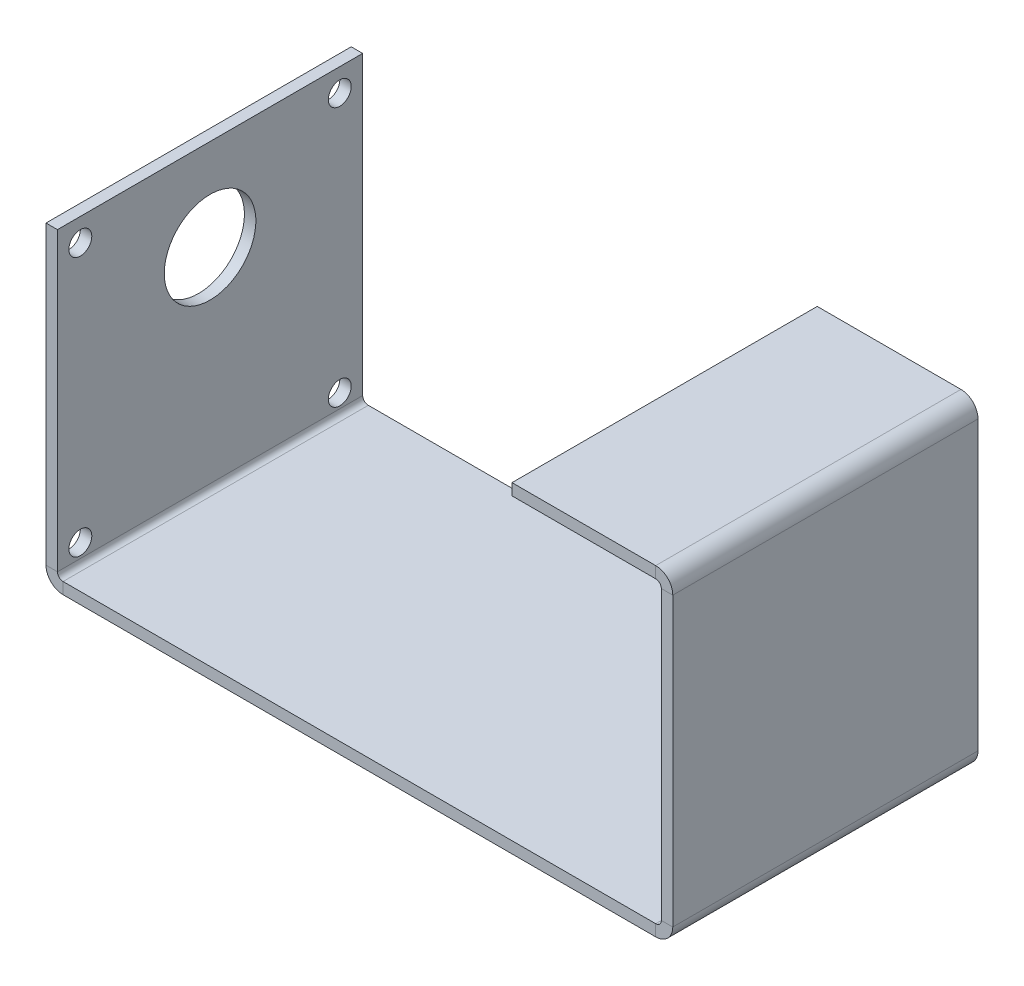
from build123d import *
from build123d.topology import SkipClean

# Parameters (mm, degrees)
SKETCH1_R               = 6
SKETCH1_R_2             = 1.5
BASE_FLANGE2_DEPTH      = 1.5
SKETCHED_START          = -40
SKETCHED_BEND1_DEPTH    = 40
SKETCHED_BEND1_2_DEPTH  = 40
SKETCHED_START_2        = -35.4999999
SKETCHED_BEND1_3_DEPTH  = 9.4999998
SKETCHED_START_3        = -13.9999999
SKETCHED_BEND1_4_DEPTH  = 9.4999998
SKETCHED_BEND1_5_DEPTH  = 1.4999999
SKETCHED_START_4        = -1.4999999
SKETCHED_BEND1_6_DEPTH  = 1.4999999
SKETCHED_START_5        = 38.93097291
SKETCHED_BEND1_7_DEPTH  = 1.5
SKETCHED_START_6        = 40.43097291
SKETCHED_BEND1_8_DEPTH  = 0.618240168
SKETCHED_START_7        = -38.5000001
SKETCHED_BEND1_9_DEPTH  = 37.00000011
SKETCHED_BEND1_10_DEPTH = 37.00000011


with BuildPart() as part:
    # Base-Flange2: sheet metal written as solids
    # Sketch1 → Base-Flange2 (new body)
    with BuildSketch(Plane(origin=(0, 0, 0), x_dir=(1, 0, 0), z_dir=(0, 1, 0))):
        Polygon((0, 0), (40, 0), (120, 0), (160, 0), (180, 0), (180, 40), (160, 40), (120, 40), (40, 40), (0, 40), align=None)
        with Locations(Location((12, 20, 0), (0, 0, 270))):
            Circle(SKETCH1_R, mode=Mode.SUBTRACT)
        with Locations(Location((3, 37, 0), (0, 0, 270))):
            Circle(SKETCH1_R_2, mode=Mode.SUBTRACT)
        with Locations(Location((37, 37, 0), (0, 0, 270))):
            Circle(SKETCH1_R_2, mode=Mode.SUBTRACT)
        with Locations(Location((37, 3, 0), (0, 0, 270))):
            Circle(SKETCH1_R_2, mode=Mode.SUBTRACT)
        with Locations(Location((3, 3, 0), (0, 0, 270))):
            Circle(SKETCH1_R_2, mode=Mode.SUBTRACT)
    extrude(amount=-BASE_FLANGE2_DEPTH)

    # Sketched Bend1: read off the stored shape, not the designer's step
    # Sketched Bend1 outline → Sketched Bend1 (cut)
    with BuildSketch(Plane.XY.offset(SKETCHED_START)):
        with BuildLine():
            Line((180, 0), (120.944250946, 0))
            ThreePointArc((120.944250946, 0), (120.127591172, -1.086838938), (118.83242709, -1.5))
            Line((118.83242709, -1.5), (180, -1.5))
            Line((180, -1.5), (180, 0))
        make_face()
        with BuildLine():
            Line((0, -1.5), (41.16757291, -1.5))
            ThreePointArc((41.16757291, -1.5), (39.872408828, -1.086838938), (39.055749054, 0))
            Line((39.055749054, 0), (0, 0))
            Line((0, 0), (0, -1.5))
        make_face()
    extrude(amount=SKETCHED_BEND1_DEPTH, mode=Mode.SUBTRACT)

    # Sketched Bend1 2 outline → Sketched Bend1 2 (add)
    with BuildSketch(Plane.XY.offset(SKETCHED_START)):
        with BuildLine():
            ThreePointArc((120.944250946, 0), (121.037612433, 0.363053267), (121.06902709, 0.7366))
            Line((121.06902709, 0.7366), (121.06902709, 38.401454181))
            ThreePointArc((121.06902709, 38.401454181), (120.413942116, 39.982969207), (118.83242709, 40.638054181))
            Line((118.83242709, 40.638054181), (100, 40.638054181))
            Line((100, 40.638054181), (100, 39.138054181))
            Line((100, 39.138054181), (118.83242709, 39.138054181))
            ThreePointArc((118.83242709, 39.138054181), (119.353281945, 38.922309036), (119.56902709, 38.401454181))
            Line((119.56902709, 38.401454181), (119.56902709, 0.7366))
            ThreePointArc((119.56902709, 0.7366), (119.353281945, 0.215745145), (118.83242709, 0))
            Line((118.83242709, 0), (120.944250946, 0))
        make_face()
    extrude(amount=SKETCHED_BEND1_2_DEPTH)

    # Sketched Bend1 3 outline → Sketched Bend1 3 (add)
    with BuildSketch(Plane.XY.offset(SKETCHED_START_2)):
        with BuildLine():
            Line((39.055749054, 0), (41.16757291, 0))
            ThreePointArc((41.16757291, 0), (40.646718055, 0.215745145), (40.43097291, 0.7366))
            Line((40.43097291, 0.7366), (40.43097291, 39.56902709))
            Line((40.43097291, 39.56902709), (38.93097291, 39.56902709))
            Line((38.93097291, 39.56902709), (38.93097291, 0.7366))
            ThreePointArc((38.93097291, 0.7366), (38.962387567, 0.363053267), (39.055749054, 0))
        make_face()
    extrude(amount=SKETCHED_BEND1_3_DEPTH)

    # Sketched Bend1 4 outline → Sketched Bend1 4 (add)
    with BuildSketch(Plane.XY.offset(SKETCHED_START_3)):
        with BuildLine():
            Line((39.055749054, 0), (41.16757291, 0))
            ThreePointArc((41.16757291, 0), (40.646718055, 0.215745145), (40.43097291, 0.7366))
            Line((40.43097291, 0.7366), (40.43097291, 39.56902709))
            Line((40.43097291, 39.56902709), (38.93097291, 39.56902709))
            Line((38.93097291, 39.56902709), (38.93097291, 0.7366))
            ThreePointArc((38.93097291, 0.7366), (38.962387567, 0.363053267), (39.055749054, 0))
        make_face()
    extrude(amount=SKETCHED_BEND1_4_DEPTH)

    # Sketched Bend1 5 outline → Sketched Bend1 5 (add)
    with BuildSketch(Plane.XY.offset(SKETCHED_START)):
        with BuildLine():
            Line((39.055749054, 0), (41.16757291, 0))
            ThreePointArc((41.16757291, 0), (40.646718055, 0.215745145), (40.43097291, 0.7366))
            Line((40.43097291, 0.7366), (40.43097291, 39.56902709))
            Line((40.43097291, 39.56902709), (38.93097291, 39.56902709))
            Line((38.93097291, 39.56902709), (38.93097291, 0.7366))
            ThreePointArc((38.93097291, 0.7366), (38.962387567, 0.363053267), (39.055749054, 0))
        make_face()
    extrude(amount=SKETCHED_BEND1_5_DEPTH)

    # Sketched Bend1 6 outline → Sketched Bend1 6 (add)
    with BuildSketch(Plane.XY.offset(SKETCHED_START_4)):
        with BuildLine():
            Line((39.055749054, 0), (41.16757291, 0))
            ThreePointArc((41.16757291, 0), (40.646718055, 0.215745145), (40.43097291, 0.7366))
            Line((40.43097291, 0.7366), (40.43097291, 39.56902709))
            Line((40.43097291, 39.56902709), (38.93097291, 39.56902709))
            Line((38.93097291, 39.56902709), (38.93097291, 0.7366))
            ThreePointArc((38.93097291, 0.7366), (38.962387567, 0.363053267), (39.055749054, 0))
        make_face()
    extrude(amount=SKETCHED_BEND1_6_DEPTH)

    # Sketched Bend1 7 outline → Sketched Bend1 7 (add)
    with BuildSketch(Plane.YZ.offset(SKETCHED_START_5)):
        with BuildLine():
            Line((36.56902709, -38.5), (39.56902709, -38.5000001))
            Line((39.56902709, -38.5000001), (39.56902709, -35.4999999))
            Line((39.56902709, -35.4999999), (36.56902709, -35.5))
            ThreePointArc((36.56902709, -35.5), (38.06902709, -37), (36.56902709, -38.5))
        make_face()
        with BuildLine():
            Line((2.569027031, -38.5), (36.56902709, -38.5))
            ThreePointArc((36.56902709, -38.5), (35.06902709, -37), (36.56902709, -35.5))
            Line((36.56902709, -35.5), (2.56902709, -35.5))
            ThreePointArc((2.56902709, -35.5), (4.06902709, -37.000000029), (2.569027031, -38.5))
        make_face()
        with BuildLine():
            Line((27.56902709, -26), (39.56902709, -26.0000001))
            Line((39.56902709, -26.0000001), (39.56902709, -13.9999999))
            Line((39.56902709, -13.9999999), (27.56902709, -14))
            ThreePointArc((27.56902709, -14), (33.56902709, -20), (27.56902709, -26))
        make_face()
        with BuildLine():
            Line((0, -38.5000001), (2.569027031, -38.5))
            ThreePointArc((2.569027031, -38.5), (1.06902709, -36.999999971), (2.56902709, -35.5))
            Line((2.56902709, -35.5), (0, -35.4999999))
            Line((0, -35.4999999), (0, -38.5000001))
        make_face()
        with BuildLine():
            Line((0, -26.0000001), (27.56902709, -26))
            ThreePointArc((27.56902709, -26), (21.56902709, -20), (27.56902709, -14))
            Line((27.56902709, -14), (0, -13.9999999))
            Line((0, -13.9999999), (0, -26.0000001))
        make_face()
        with BuildLine():
            Line((36.56902709, -4.5), (39.56902709, -4.5000001))
            Line((39.56902709, -4.5000001), (39.56902709, -1.4999999))
            Line((39.56902709, -1.4999999), (36.56902709, -1.5))
            ThreePointArc((36.56902709, -1.5), (38.06902709, -3), (36.56902709, -4.5))
        make_face()
        with BuildLine():
            Line((2.56902709, -4.5), (36.56902709, -4.5))
            ThreePointArc((36.56902709, -4.5), (35.06902709, -3), (36.56902709, -1.5))
            Line((36.56902709, -1.5), (2.569027095, -1.5))
            ThreePointArc((2.569027095, -1.5), (4.06902709, -3.000000002), (2.56902709, -4.5))
        make_face()
        with BuildLine():
            Line((0, -4.5000001), (2.56902709, -4.5))
            ThreePointArc((2.56902709, -4.5), (1.06902709, -2.999999998), (2.569027095, -1.5))
            Line((2.569027095, -1.5), (0, -1.4999999))
            Line((0, -1.4999999), (0, -4.5000001))
        make_face()
    extrude(amount=SKETCHED_BEND1_7_DEPTH)

    # Sketched Bend1 8 outline → Sketched Bend1 8 (add)
    with BuildSketch(Plane.YZ.offset(SKETCHED_START_6)):
        with BuildLine():
            Line((0, -38.5000001), (2.569027031, -38.5))
            ThreePointArc((2.569027031, -38.5), (1.06902709, -36.999999971), (2.56902709, -35.5))
            Line((2.56902709, -35.5), (0, -35.4999999))
            Line((0, -35.4999999), (0, -38.5000001))
        make_face()
        with BuildLine():
            Line((0, -26.0000001), (27.56902709, -26))
            ThreePointArc((27.56902709, -26), (21.56902709, -20), (27.56902709, -14))
            Line((27.56902709, -14), (0, -13.9999999))
            Line((0, -13.9999999), (0, -26.0000001))
        make_face()
        with BuildLine():
            Line((0, -4.5000001), (2.56902709, -4.5))
            ThreePointArc((2.56902709, -4.5), (1.06902709, -2.999999998), (2.569027095, -1.5))
            Line((2.569027095, -1.5), (0, -1.4999999))
            Line((0, -1.4999999), (0, -4.5000001))
        make_face()
    extrude(amount=SKETCHED_BEND1_8_DEPTH)

    # Sketched Bend1 9 outline → Sketched Bend1 9 (cut)
    with SkipClean():  # the faces are left unmerged after this step: merging them gives an invalid solid
        with BuildSketch(Plane.XY.offset(SKETCHED_START_7)):
            with BuildLine():
                ThreePointArc((40.43097291, 0.7366), (40.606429696, 0.259423037), (41.049213078, 0.009571452))
                Line((41.049213078, 0.009571452), (41.049213078, 27.56902709))
                Line((41.049213078, 27.56902709), (40.43097291, 27.56902709))
                Line((40.43097291, 27.56902709), (40.43097291, 0.7366))
            make_face()
            with BuildLine():
                ThreePointArc((39.055749054, 0), (38.962387567, 0.363053267), (38.93097291, 0.7366))
                Line((38.93097291, 0.7366), (38.93097291, 0))
                Line((38.93097291, 0), (39.055749054, 0))
            make_face()
        extrude(amount=SKETCHED_BEND1_9_DEPTH, mode=Mode.SUBTRACT)

    # Sketched Bend1 10 outline → Sketched Bend1 10 (add)
    with SkipClean():  # the faces are left unmerged after this step: merging them gives an invalid solid
        with BuildSketch(Plane.XY.offset(SKETCHED_START_7)):
            with BuildLine():
                ThreePointArc((41.16757291, 0), (41.108199805, 0.002396762), (41.049213078, 0.009571452))
                Line((41.049213078, 0.009571452), (41.049213078, 0))
                Line((41.049213078, 0), (41.16757291, 0))
            make_face()
        extrude(amount=SKETCHED_BEND1_10_DEPTH)


solid = part.part
